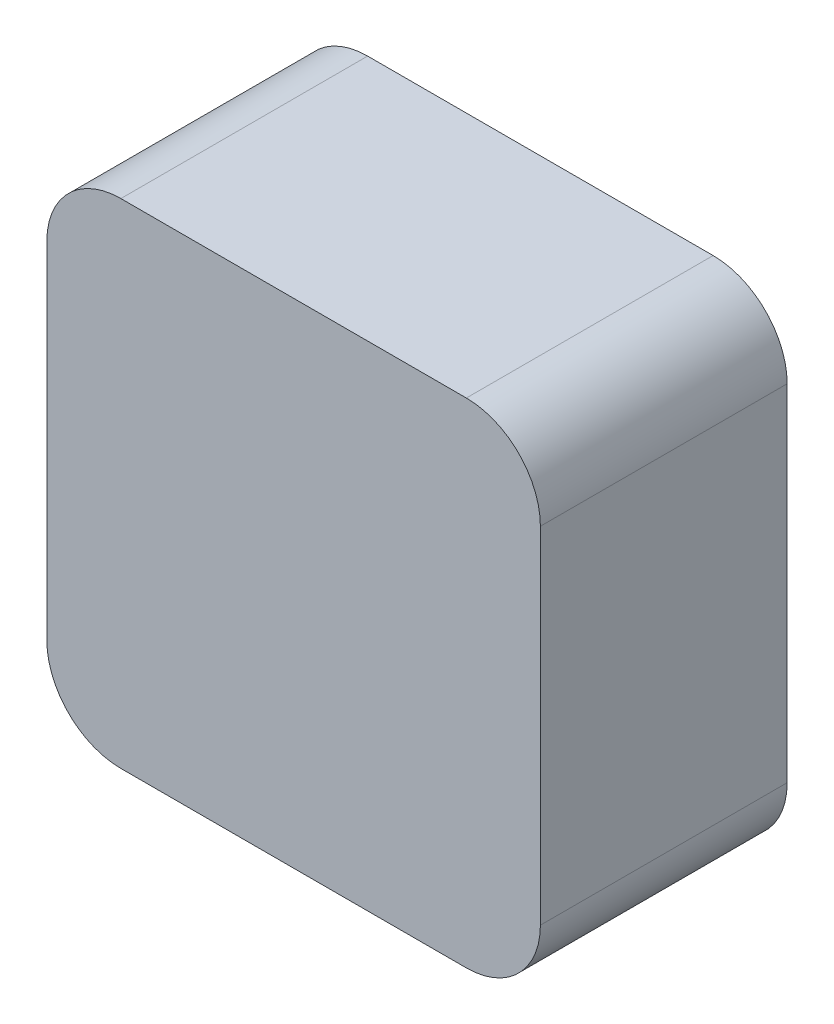
from build123d import *

# Parameters (mm, degrees)
SKETCH1_W           = 10
SKETCH1_H           = 10
SKETCH1_R           = 1.5
BOSS_EXTRUDE1_DEPTH = 5
FILLET1_R           = 1.5
SKETCH2_R           = 1.6
BOSS_EXTRUDE2_DEPTH = 1
SKETCH3_R           = 2.25
CUT_EXTRUDE1_DEPTH  = 4


with BuildPart() as part:
    # Sketch1 → Boss-Extrude1 (new body)
    with BuildSketch(Plane.XY):
        with Locations((-140, 155.5)):
            Rectangle(SKETCH1_W, SKETCH1_H)
        with Locations((-140, 155.5)):
            Circle(SKETCH1_R, mode=Mode.SUBTRACT)
    extrude(amount=BOSS_EXTRUDE1_DEPTH)

    # Fillet1
    fillet1_edges = [part.edges().sort_by_distance(p)[0] for p in [
        (-145, 150.5, 2.5),
        (-145, 160.5, 2.5),
        (-135, 160.5, 2.5),
        (-135, 150.5, 2.5),
    ]]
    fillet(fillet1_edges, radius=FILLET1_R)

    # Sketch2 → Boss-Extrude2 (add)
    with BuildSketch(Plane.XY.offset(5)):
        with Locations((-140, 155.5)):
            Circle(SKETCH2_R)
    extrude(amount=-BOSS_EXTRUDE2_DEPTH)

    # Sketch3 → Cut-Extrude1 (cut)
    with BuildSketch(Plane(origin=(0, 0, 0), x_dir=(-1, 0, 0), z_dir=(0, 0, -1))):
        with Locations((140, 155.5)):
            Circle(SKETCH3_R)
    extrude(amount=-CUT_EXTRUDE1_DEPTH, mode=Mode.SUBTRACT)


solid = part.part
